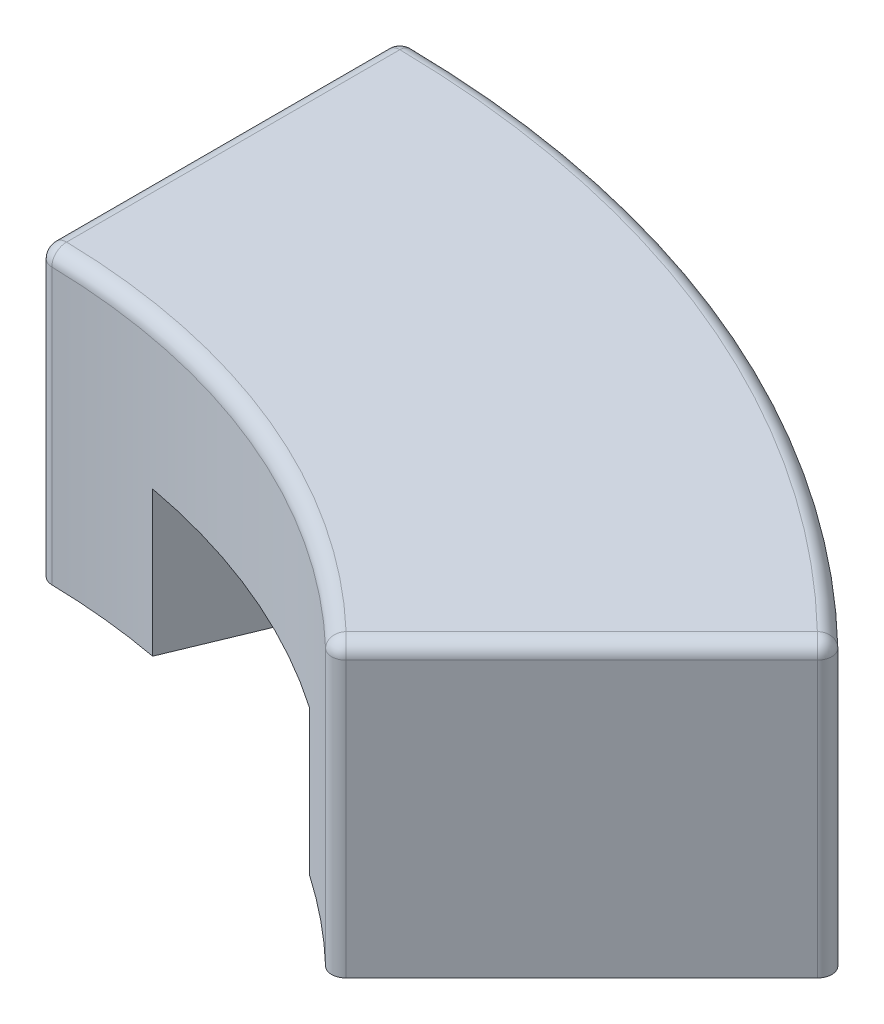
from build123d import *

# Parameters (mm, degrees)
BOSS_EXTRUDE1_DEPTH = 400
FILLET1_R           = 20
CUT_EXTRUDE2_DEPTH  = 1828.500193899


with BuildPart() as part:
    # Sketch1 → Boss-Extrude1 (new body)
    with BuildSketch(Plane(origin=(0, 0, 0), x_dir=(1, 0, 0), z_dir=(0, 1, 0))):
        with BuildLine():
            Line((0, 960), (0, 1460))
            ThreePointArc((0, 1460), (558.717811253, 1348.864117466), (1032.375900532, 1032.375900532))
            Line((1032.375900532, 1032.375900532), (678.822509939, 678.822509939))
            ThreePointArc((678.822509939, 678.822509939), (367.37609507, 886.924351211), (0, 960))
        make_face()
    extrude(amount=BOSS_EXTRUDE1_DEPTH)

    # Fillet1
    fillet1_edges = [part.edges().sort_by_distance(p)[0] for p in [
        (558.717811253, 400, -1348.864117466),
        (1032.375900532, 200, -1032.375900532),
        (0, 200, -1460),
        (0, 400, -1210),
        (0, 200, -960),
        (367.37609507, 400, -886.924351211),
        (855.599205236, 400, -855.599205236),
        (678.822509939, 200, -678.822509939),
    ]]
    fillet(fillet1_edges, radius=FILLET1_R)

    # Sketch4 → Cut-Extrude2 (cut, through all)
    with BuildSketch(Plane(origin=(0, 0, 0), x_dir=(0.9238795325112864, 0, 0.3826834323650906), z_dir=(-0.3826834323650906, 0, 0.9238795325112864))):
        Polygon((0, 0), (200, 0), (200, 200), (-200, 200), (-200, 0), align=None)
    extrude(amount=-CUT_EXTRUDE2_DEPTH, mode=Mode.SUBTRACT)


solid = part.part
